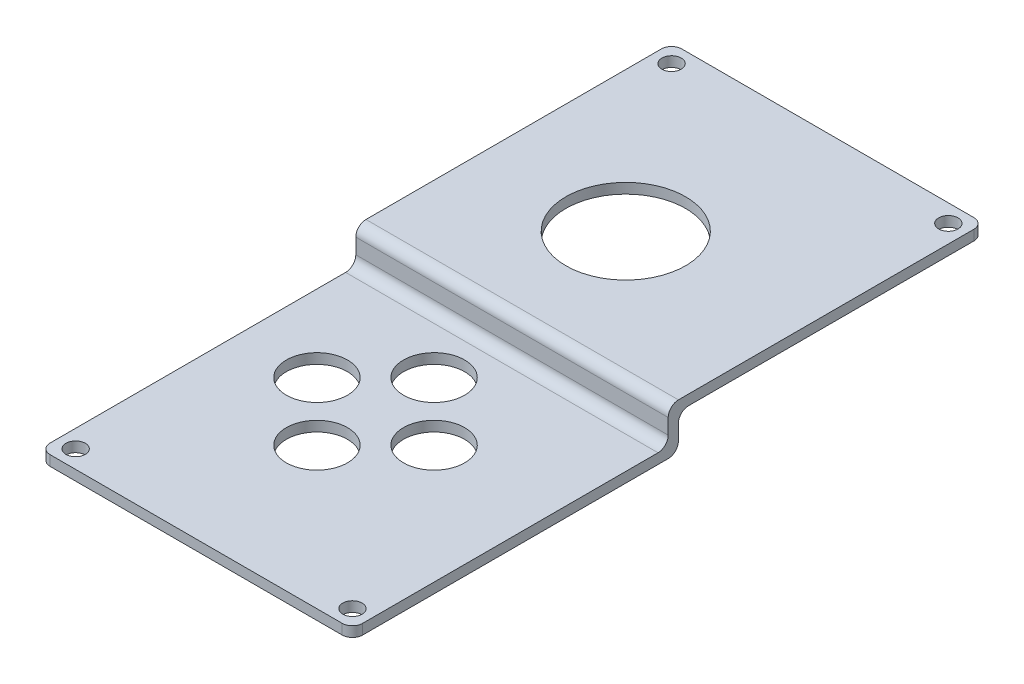
from build123d import *

# Parameters (mm, degrees)
BOSS_EXTRUDE1_DEPTH = 61.34
SKETCH3_R           = 11.75
SKETCH3_R_2         = 1.9
CUT_EXTRUDE1_DEPTH  = 90.104408421
SKETCH4_R           = 6
SKETCH4_R_2         = 1.9
CUT_EXTRUDE2_DEPTH  = 89.924662496
FILLET1_R           = 2
FILLET3_R           = 2


with BuildPart() as part:
    # Sketch2 → Boss-Extrude1 (new body)
    with BuildSketch(Plane(origin=(0, 0, 0), x_dir=(0, 0, -1), z_dir=(1, 0, 0))):
        Polygon((0, 0), (60, 0), (60, 2), (-2, 2), (-2, -5), (-64, -5), (-64, -7), (0, -7), align=None)
    extrude(amount=BOSS_EXTRUDE1_DEPTH)

    # Sketch3 → Cut-Extrude1 (cut, through all)
    with BuildSketch(Plane(origin=(0, 2, 0), x_dir=(1, 0, 0), z_dir=(0, 1, 0))):
        with Locations((27.5, 23.5)):
            Circle(SKETCH3_R)
        with Locations((57.84, 56.5)):
            Circle(SKETCH3_R_2)
        with Locations((3.5, 56.5)):
            Circle(SKETCH3_R_2)
    extrude(amount=-CUT_EXTRUDE1_DEPTH, mode=Mode.SUBTRACT)

    # Sketch4 → Cut-Extrude2 (cut, through all)
    with BuildSketch(Plane(origin=(0, -5, 0), x_dir=(1, 0, 0), z_dir=(0, 1, 0))):
        with Locations((38.07, -24.7)):
            Circle(SKETCH4_R)
        with Locations((26.57, -36.2)):
            Circle(SKETCH4_R)
        with Locations((15.07, -24.7)):
            Circle(SKETCH4_R)
        with Locations((26.57, -13.2)):
            Circle(SKETCH4_R)
        with Locations((57.84, -60.5)):
            Circle(SKETCH4_R_2)
        with Locations((3.5, -60.5)):
            Circle(SKETCH4_R_2)
    extrude(amount=-CUT_EXTRUDE2_DEPTH, mode=Mode.SUBTRACT)

    # Fillet1
    fillet1_edges = [part.edges().sort_by_distance(p)[0] for p in [
        (30.67, 0, 0),
        (30.67, -7, 0),
        (30.67, 2, 2),
        (30.67, -5, 2),
    ]]
    fillet(fillet1_edges, radius=FILLET1_R)

    # Fillet3
    fillet3_edges = [part.edges().sort_by_distance(p)[0] for p in [
        (61.34, 1, -60),
        (61.34, -6, 64),
        (0, -6, 64),
        (0, 1, -60),
    ]]
    fillet(fillet3_edges, radius=FILLET3_R)


solid = part.part
